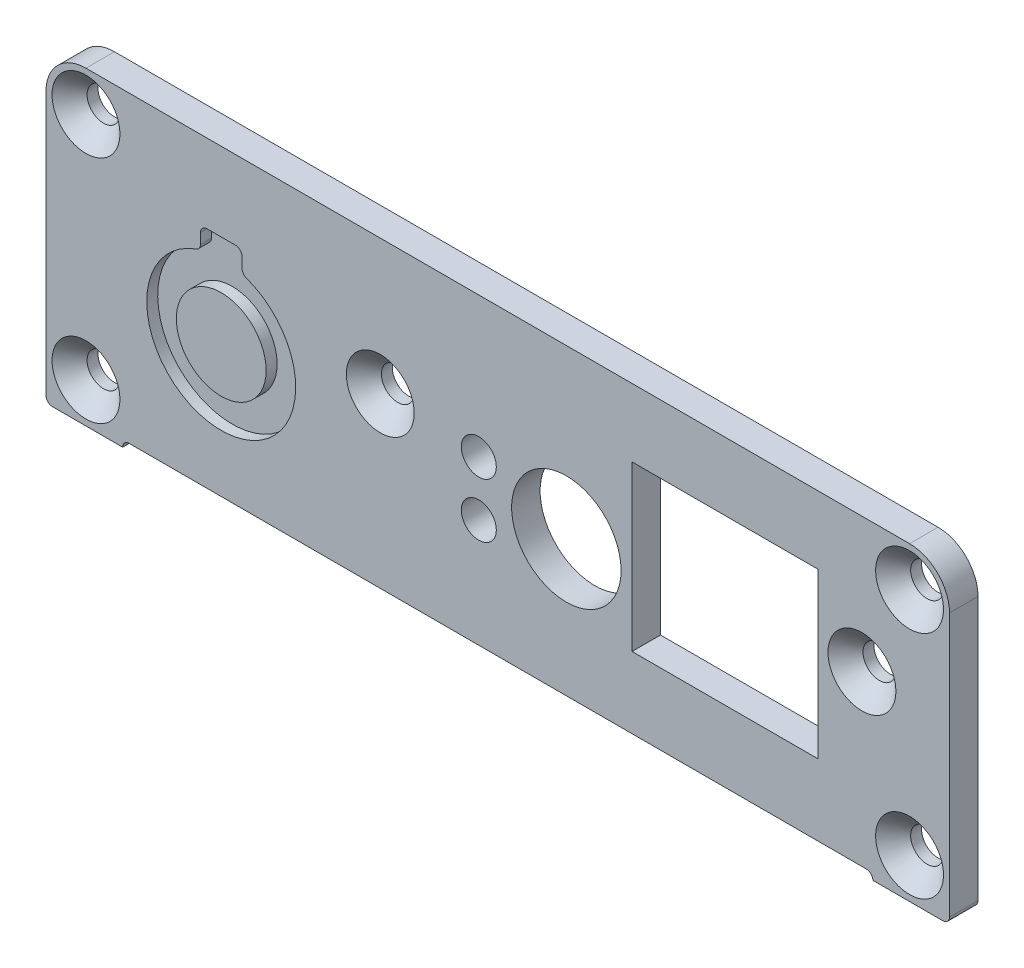
from build123d import *

# Parameters (mm, degrees)
SKETCH1_R           = 1.5
BOSS_EXTRUDE1_DEPTH = 2.6
FILLET1_R           = 3.65
FILLET2_R           = 0.6
CHAMFER1_SIZE       = 1.6
SKETCH2_R           = 1.499234097
SKETCH2_R_2         = 4.997446991
SKETCH2_R_3         = 1.599183037
SKETCH2_W           = 16.99131977
SKETCH2_H           = 14.992340973
CUT_EXTRUDE1_DEPTH  = 2.6
CHAMFER2_SIZE       = 1.6
SKETCH3_R           = 6.8
CUT_EXTRUDE2_DEPTH  = 1
SKETCH4_R           = 4.1
CUT_EXTRUDE3_DEPTH  = 3
SKETCH5_W           = 3.8
SKETCH5_H           = 3.391058966
CUT_EXTRUDE4_DEPTH  = 1
FILLET3_R           = 0.6
SKETCH6_R           = 4.1
BOSS_EXTRUDE3_DEPTH = 1


with BuildPart() as part:
    # Sketch1 → Boss-Extrude1 (new body)
    with BuildSketch(Plane.XY):
        Polygon((7, 0), (7, 0.6), (75.5, 0.6), (75.5, 0), (82.5, 0), (82.5, 28.3), (0, 28.3), (0, 0), align=None)
        with Locations((3.65, 24.65)):
            Circle(SKETCH1_R, mode=Mode.SUBTRACT)
        with Locations((3.65, 3.65)):
            Circle(SKETCH1_R, mode=Mode.SUBTRACT)
        with Locations((78.85, 24.65)):
            Circle(SKETCH1_R, mode=Mode.SUBTRACT)
        with Locations((78.85, 3.65)):
            Circle(SKETCH1_R, mode=Mode.SUBTRACT)
    extrude(amount=BOSS_EXTRUDE1_DEPTH)

    # Fillet1
    fillet1_edges = [part.edges().sort_by_distance(p)[0] for p in [
        (0, 28.3, 1.3),
        (82.5, 28.3, 1.3),
    ]]
    fillet(fillet1_edges, radius=FILLET1_R)

    # Fillet2
    fillet2_edges = [part.edges().sort_by_distance(p)[0] for p in [
        (75.5, 0.6, 1.3),
        (7, 0.6, 1.3),
    ]]
    fillet(fillet2_edges, radius=FILLET2_R - 0.0001)  # a hair under: the kernel refuses the full size
    fillet2_2_edges = [part.edges().sort_by_distance(p)[0] for p in [
        (82.5, 0, 1.3),
        (0, 0, 1.3),
    ]]
    fillet(fillet2_2_edges, radius=FILLET2_R)

    # Chamfer1
    chamfer1_edges = [part.edges().sort_by_distance(p)[0] for p in [
        (2.15, 24.65, 2.6),
        (2.15, 3.65, 2.6),
        (77.35, 24.65, 2.6),
        (77.35, 3.65, 2.6),
    ]]
    chamfer(chamfer1_edges, length=CHAMFER1_SIZE)

    # Sketch2 → Cut-Extrude1 (cut)
    with BuildSketch(Plane.XY.offset(2.6)):
        with Locations((74.5, 16)):
            Circle(SKETCH2_R)
        with Locations((30.522466477, 16)):
            Circle(SKETCH2_R)
        with Locations((47.513786247, 13.001531805)):
            Circle(SKETCH2_R_2)
        with Locations((39.517871061, 15.500255301)):
            Circle(SKETCH2_R_3)
        with Locations((39.517871061, 10.50280831)):
            Circle(SKETCH2_R_3)
        with Locations((62.006382522, 14.600714843)):
            Rectangle(SKETCH2_W, SKETCH2_H)
    extrude(amount=-CUT_EXTRUDE1_DEPTH, mode=Mode.SUBTRACT)

    # Chamfer2
    chamfer2_edges = [part.edges().sort_by_distance(p)[0] for p in [
        (73.000765903, 16, 2.6),
        (29.023232379, 16, 2.6),
    ]]
    chamfer(chamfer2_edges, length=CHAMFER2_SIZE)

    # Sketch3 → Cut-Extrude2 (cut)
    with BuildSketch(Plane.XY.offset(2.6)):
        with Locations((16, 12.625)):
            Circle(SKETCH3_R)
    extrude(amount=-CUT_EXTRUDE2_DEPTH, mode=Mode.SUBTRACT)

    # Sketch4 → Cut-Extrude3 (cut)
    with BuildSketch(Plane.XY.offset(1.6)):
        with Locations((16, 12.625)):
            Circle(SKETCH4_R)
    extrude(amount=-CUT_EXTRUDE3_DEPTH, mode=Mode.SUBTRACT)

    # Sketch5 → Cut-Extrude4 (cut)
    with BuildSketch(Plane.XY.offset(2.6)):
        with Locations((16, 19.429470517)):
            Rectangle(SKETCH5_W, SKETCH5_H)
    extrude(amount=-CUT_EXTRUDE4_DEPTH, mode=Mode.SUBTRACT)

    # Fillet3
    fillet3_edges = [part.edges().sort_by_distance(p)[0] for p in [
        (14.1, 19.154165337, 2.1),
        (17.9, 19.154165337, 2.1),
        (17.9, 21.125, 2.1),
        (14.1, 21.125, 2.1),
    ]]
    fillet(fillet3_edges, radius=FILLET3_R)


with BuildPart() as body_2:
    # Sketch6 → Boss-Extrude3 (new body)
    with BuildSketch(Plane.XY.offset(1.6)):
        with Locations((16, 12.625)):
            Circle(SKETCH6_R)
    extrude(amount=BOSS_EXTRUDE3_DEPTH)


solid = Compound([part.part, body_2.part])
